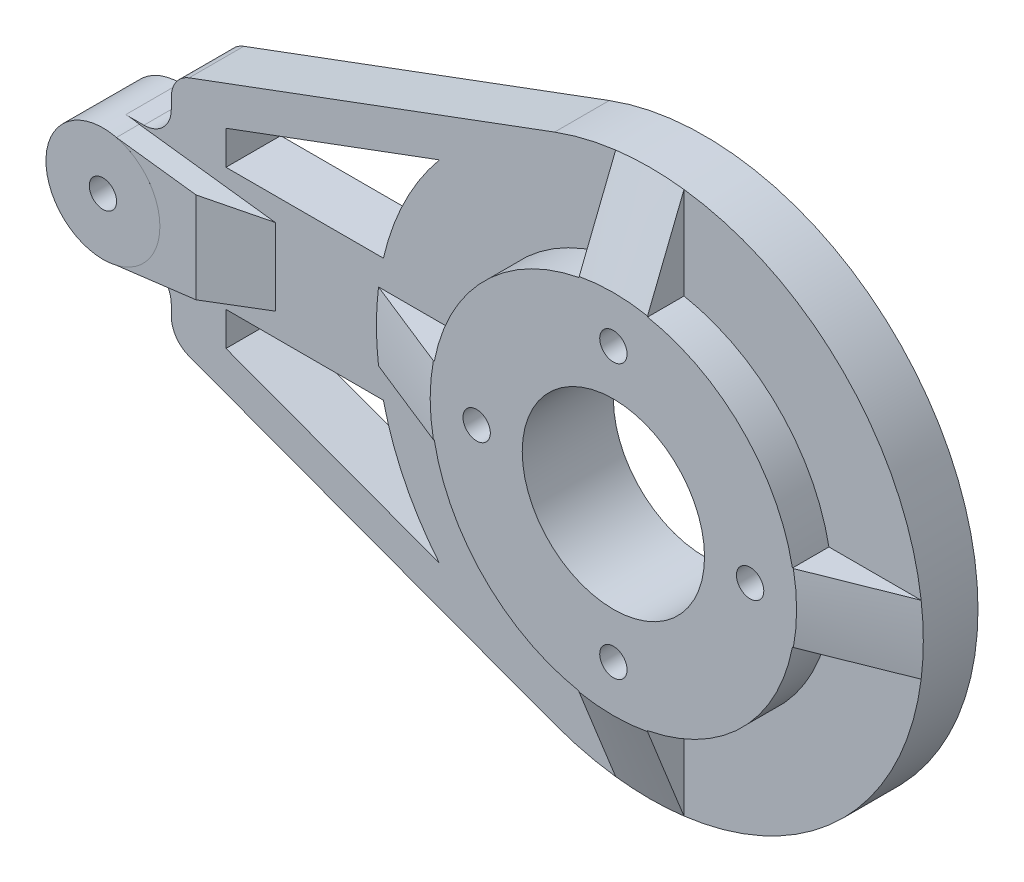
from build123d import *
from OCP.BRepFilletAPI import BRepFilletAPI_MakeChamfer
from build123d.topology import SkipClean

# Parameters (mm, degrees)
SKETCH2_R           = 40
SKETCH2_R_2         = 20
BOSS_EXTRUDE1_DEPTH = 8
BOSS_EXTRUDE2_START = 12
SKETCH3_R           = 20
BOSS_EXTRUDE2_DEPTH = 12
SKETCH4_R           = 7.5
CUT_EXTRUDE1_DEPTH  = 10
SKETCH5_R           = 3
CUT_EXTRUDE2_DEPTH  = 29
BOSS_EXTRUDE3_DEPTH = 8
CHAMFER3_SIZE       = 8
CHAMFER3_SIZE_2     = 19.800694827
BOSS_EXTRUDE4_DEPTH = 12
FILLET1_R           = 6
CUT_EXTRUDE3_DEPTH  = 10
SKETCH9_R           = 3
CUT_EXTRUDE4_DEPTH  = 6
CUT_EXTRUDE5_START  = -22
CUT_EXTRUDE5_DEPTH  = 22
SKETCH12_R          = 12.5
SKETCH12_R_2        = 3
BOSS_EXTRUDE5_DEPTH = 5
BOSS_EXTRUDE6_DEPTH = 5
CHAMFER7_SIZE       = 8
CHAMFER7_SIZE_2     = 19.800694827


# Some blends are built 0.0001 mm under size
with BuildPart() as part:
    # Sketch2 → Boss-Extrude1 (new body)
    with BuildSketch(Plane.XY):
        Circle(SKETCH2_R)
        Circle(SKETCH2_R_2, mode=Mode.SUBTRACT)
    extrude(amount=BOSS_EXTRUDE1_DEPTH)

    # Sketch3 → Boss-Extrude2 (add)
    with SkipClean():  # the faces are left unmerged after this step: merging them gives an invalid solid
        with BuildSketch(Plane(origin=(0, 0, 0), x_dir=(-1, 0, 0), z_dir=(0, 0, -1)).offset(BOSS_EXTRUDE2_START)):
            with BuildLine():
                Line((105, -25), (105, 25))
                Line((105, 25), (20.894189842, 56.244402662))
                ThreePointArc((20.894189842, 56.244402662), (-60, 0), (20.894189842, -56.244402662))
                Line((20.894189842, -56.244402662), (105, -25))
            make_face()
            Circle(SKETCH3_R, mode=Mode.SUBTRACT)
        extrude(amount=-BOSS_EXTRUDE2_DEPTH)

    # Sketch4 → Cut-Extrude1 (cut)
    with SkipClean():  # the faces are left unmerged after this step: merging them gives an invalid solid
        with BuildSketch(Plane(origin=(0, 0, -12), x_dir=(-1, 0, 0), z_dir=(0, 0, -1))):
            with Locations((0, 30)):
                Circle(SKETCH4_R)
            with Locations((30, 0)):
                Circle(SKETCH4_R)
            with Locations((0, -30)):
                Circle(SKETCH4_R)
            with Locations((-30, 0)):
                Circle(SKETCH4_R)
        extrude(amount=-CUT_EXTRUDE1_DEPTH, mode=Mode.SUBTRACT)

    # Sketch5 → Cut-Extrude2 (cut)
    with SkipClean():  # the faces are left unmerged after this step: merging them gives an invalid solid
        with BuildSketch(Plane(origin=(0, 0, -2), x_dir=(-1, 0, 0), z_dir=(0, 0, -1))):
            with Locations((30, 0)):
                Circle(SKETCH5_R)
            with Locations((0, -30)):
                Circle(SKETCH5_R)
            with Locations((-30, 0)):
                Circle(SKETCH5_R)
            with Locations((0, 30)):
                Circle(SKETCH5_R)
        extrude(amount=-CUT_EXTRUDE2_DEPTH, mode=Mode.SUBTRACT)

    # Sketch6 → Boss-Extrude3 (add)
    with SkipClean():  # the faces are left unmerged after this step: merging them gives an invalid solid
        with BuildSketch(Plane.XY):
            with BuildLine():
                Line((39.290584114, -7.5), (59.529404499, -7.5))
                ThreePointArc((59.529404499, -7.5), (60, 0), (59.529404499, 7.5))
                Line((59.529404499, 7.5), (39.290584114, 7.5))
                ThreePointArc((39.290584114, 7.5), (40, 0), (39.290584114, -7.5))
            make_face()
            with BuildLine():
                Line((-7.5, 39.290584114), (-7.5, 59.529404499))
                ThreePointArc((-7.5, 59.529404499), (0, 60), (7.5, 59.529404499))
                Line((7.5, 59.529404499), (7.5, 39.290584114))
                ThreePointArc((7.5, 39.290584114), (0, 40), (-7.5, 39.290584114))
            make_face()
            with BuildLine():
                Line((-7.5, -39.290584114), (-7.5, -59.529404499))
                ThreePointArc((-7.5, -59.529404499), (0, -60), (7.5, -59.529404499))
                Line((7.5, -59.529404499), (7.5, -39.290584114))
                ThreePointArc((7.5, -39.290584114), (0, -40), (-7.5, -39.290584114))
            make_face()
            with BuildLine():
                Line((-39.290584114, 7.5), (-59.529404499, 7.5))
                ThreePointArc((-59.529404499, 7.5), (-60, 0), (-59.529404499, -7.5))
                Line((-59.529404499, -7.5), (-39.290584114, -7.5))
                ThreePointArc((-39.290584114, -7.5), (-40, 0), (-39.290584114, 7.5))
            make_face()
        extrude(amount=BOSS_EXTRUDE3_DEPTH)

    # Chamfer3
    chamfer3_edges_1 = [part.edges().sort_by_distance(p)[0] for p in [
        (0, 60, 8),
    ]]
    chamfer3_side_1 = [part.faces().sort_by_distance(p)[0] for p in [
        (0, 60, 7.84),
    ]]
    chamfer3_edges_2 = [part.edges().sort_by_distance(p)[0] for p in [
        (60, 0, 8),
    ]]
    chamfer3_side_2 = [part.faces().sort_by_distance(p)[0] for p in [
        (59.84, 0, 8),
    ]]
    chamfer3_edges_3 = [part.edges().sort_by_distance(p)[0] for p in [
        (-60, 0, 8),
    ]]
    chamfer3_side_3 = [part.faces().sort_by_distance(p)[0] for p in [
        (-59.84, 0, 8),
    ]]
    chamfer3_edges_4 = [part.edges().sort_by_distance(p)[0] for p in [
        (0, -60, 8),
    ]]
    chamfer3_side_4 = [part.faces().sort_by_distance(p)[0] for p in [
        (0, -59.84, 8),
    ]]
    chamfer3 = BRepFilletAPI_MakeChamfer(part.part.solid().wrapped)
    for e in chamfer3_edges_1:
        chamfer3.Add(CHAMFER3_SIZE - 0.0001, CHAMFER3_SIZE_2 - 0.0001, e.wrapped, chamfer3_side_1[0].wrapped)
    for e in chamfer3_edges_2:
        chamfer3.Add(CHAMFER3_SIZE_2 - 0.0001, CHAMFER3_SIZE - 0.0001, e.wrapped, chamfer3_side_2[0].wrapped)
    for e in chamfer3_edges_3:
        chamfer3.Add(CHAMFER3_SIZE_2 - 0.0001, CHAMFER3_SIZE - 0.0001, e.wrapped, chamfer3_side_3[0].wrapped)
    for e in chamfer3_edges_4:
        chamfer3.Add(CHAMFER3_SIZE_2 - 0.0001, CHAMFER3_SIZE - 0.0001, e.wrapped, chamfer3_side_4[0].wrapped)
    add(Compound.cast(chamfer3.Shape()), mode=Mode.REPLACE)  # a hair under: the kernel refuses the full size

    # Sketch7 → Boss-Extrude4 (add)
    with SkipClean():  # the faces are left unmerged after this step: merging them gives an invalid solid
        with BuildSketch(Plane(origin=(0, 0, -12), x_dir=(-1, 0, 0), z_dir=(0, 0, -1))):
            with BuildLine():
                Line((115, 12.5), (105, 12.5))
                Line((105, 12.5), (105, -12.5))
                Line((105, -12.5), (115, -12.5))
                ThreePointArc((115, -12.5), (127.5, 0), (115, 12.5))
            make_face()
        extrude(amount=-BOSS_EXTRUDE4_DEPTH)

    # Fillet1
    fillet1_edges = [part.edges().sort_by_distance(p)[0] for p in [
        (-105, -25, -6),
        (-105, 25, -6),
        (-105, -12.5, -6),
        (-105, 12.5, -6),
    ]]
    fillet(fillet1_edges, radius=FILLET1_R)

    # Sketch8 → Cut-Extrude3 (cut)
    with SkipClean():  # the faces are left unmerged after this step: merging them gives an invalid solid
        with BuildSketch(Plane(origin=(0, 0, -12), x_dir=(-1, 0, 0), z_dir=(0, 0, -1))):
            Polygon((118.778590974, 6.485027647), (111.2730968, 6.514869597), (107.494505826, 0.02984195), (111.221409026, -6.485027647), (118.7269032, -6.514869597), (122.505494174, -0.02984195), align=None)
        extrude(amount=-CUT_EXTRUDE3_DEPTH, mode=Mode.SUBTRACT)

    # Sketch9 → Cut-Extrude4 (cut)
    with SkipClean():  # the faces are left unmerged after this step: merging them gives an invalid solid
        with BuildSketch(Plane(origin=(0, 0, -2), x_dir=(-1, 0, 0), z_dir=(0, 0, -1))):
            with Locations((115, 0)):
                Circle(SKETCH9_R)
        extrude(amount=-CUT_EXTRUDE4_DEPTH, mode=Mode.SUBTRACT)

    # Sketch10 → Cut-Extrude5 (cut)
    with SkipClean():  # the faces are left unmerged after this step: merging them gives an invalid solid
        with BuildSketch(Plane.XY.offset(CUT_EXTRUDE5_START)):
            with BuildLine():
                Line((-58.46152581, -13.5), (-93, -13.5))
                Line((-93, -13.5), (-93, -20.923688206))
                Line((-93, -20.923688206), (-46.167935821, -38.321295672))
                ThreePointArc((-46.167935821, -38.321295672), (-53.766674065, -26.62977206), (-58.46152581, -13.5))
            make_face()
            with BuildLine():
                Line((-93, 20.923688206), (-46.167935821, 38.321295672))
                ThreePointArc((-46.167935821, 38.321295672), (-53.766674065, 26.62977206), (-58.46152581, 13.5))
                Line((-58.46152581, 13.5), (-93, 13.5))
                Line((-93, 13.5), (-93, 20.923688206))
            make_face()
        extrude(amount=CUT_EXTRUDE5_DEPTH, mode=Mode.SUBTRACT)

    # Sketch12 → Boss-Extrude5 (add)
    with SkipClean():  # the faces are left unmerged after this step: merging them gives an invalid solid
        with BuildSketch(Plane.XY):
            with Locations(Location((-115, 0, 0), (0, 0, 270))):
                Circle(SKETCH12_R)
            with Locations(Location((-115, 0, 0), (0, 0, 180))):
                Circle(SKETCH12_R_2, mode=Mode.SUBTRACT)
        extrude(amount=BOSS_EXTRUDE5_DEPTH)

    # Sketch13 → Boss-Extrude6 (add)
    with SkipClean():  # the faces are left unmerged after this step: merging them gives an invalid solid
        with BuildSketch(Plane.XY):
            with BuildLine():
                Line((-74.743265697, 7.5), (-112.037181998, 12.144415139))
                ThreePointArc((-112.037181998, 12.144415139), (-102.499395631, 0), (-112.037181998, -12.144415139))
                Line((-112.037181998, -12.144415139), (-74.743265697, -7.5))
                Line((-74.743265697, -7.5), (-74.743265697, 7.5))
            make_face()
        extrude(amount=BOSS_EXTRUDE6_DEPTH)

    # Chamfer7
    # the kernel refuses this chamfer: 19.800694827, 8 mm, written as the material it takes off along each edge
    with BuildSketch(Plane(origin=(-74.743265697, -58.842983777, 5), x_dir=(0.08816706473193492, 0, -0.9961057015681392), z_dir=(0, 1, 0))) as chamfer7_piece_1_section:
        Polygon((CHAMFER7_SIZE * 0.996105701568, CHAMFER7_SIZE * 0.0881670647319), (-CHAMFER7_SIZE_2 * 0.0881670647334, CHAMFER7_SIZE_2 * 0.996105701585), (0, 0), align=None)
    chamfer7_piece_1 = extrude(amount=117.685967554, mode=Mode.PRIVATE)
    chamfer7_piece_1 = split(chamfer7_piece_1, bisect_by=Plane(origin=(-82.305145915, 0, 0), z_dir=(0, 0, 1)), keep=Keep.TOP, mode=Mode.PRIVATE)
    add(chamfer7_piece_1, mode=Mode.SUBTRACT)


solid = part.part
